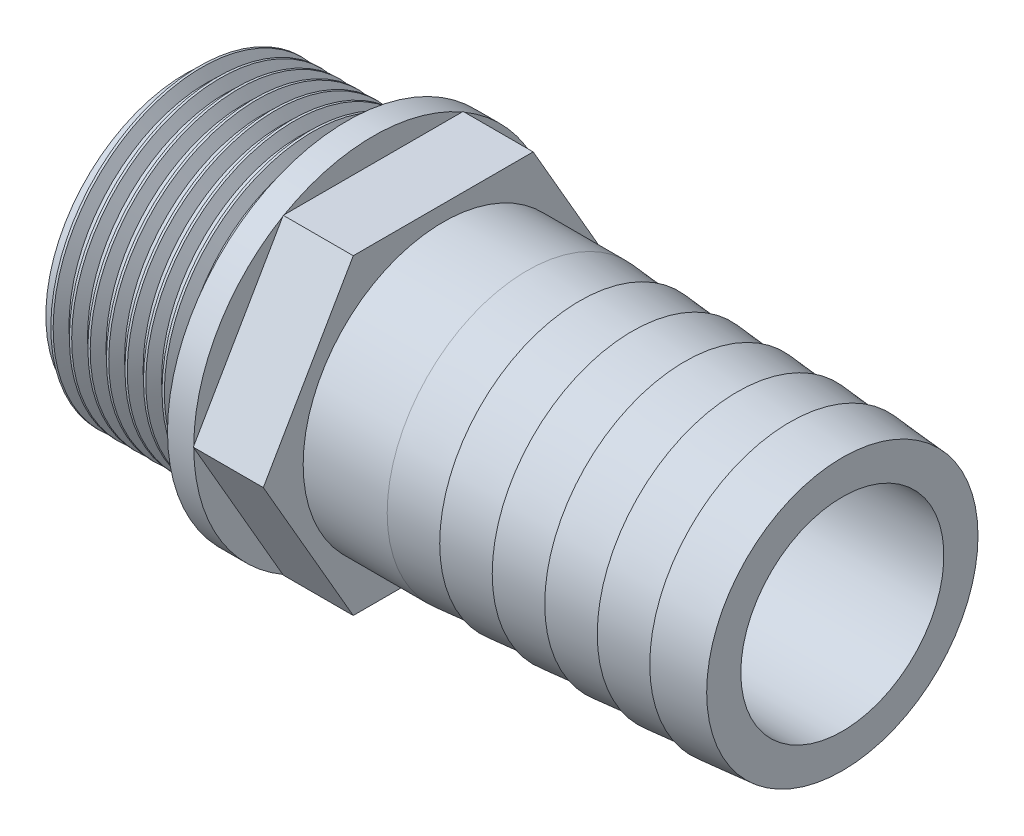
from build123d import *

# Parameters (mm, degrees)
DODANIE_WYCI_GNI_CIE1_START = 8
SZKIC2_R                    = 16
DODANIE_WYCI_GNI_CIE1_DEPTH = 8
GWINT1_PITCH                = 2.116666667


with BuildPart() as part:
    # Szkic1 → Obrót1 (revolve)
    with BuildSketch(Plane.XY, mode=Mode.PRIVATE) as obr_t1_sk:
        Polygon((0, 16), (9, 16), (15, 15.5), (15, 16), (21, 15.5), (21, 16), (27, 15.5), (27, 16), (33, 15.5), (33, 16), (39, 15.5), (39, 16), (45, 15.5), (45, 11.6), (-30, 11.6), (-30, 16), (-11.6, 16), (-11.6, 20.5), (-8.6, 20.5), (-8.6, 16), align=None)
    revolve(obr_t1_sk.sketch.rotate(Axis((0, 0, 0), (1, 0, 0)), 90), axis=Axis((0, 0, 0), (1, 0, 0)))

    # Szkic2 → Dodanie-wyciągnięcie1 (add)
    with BuildSketch(Plane(origin=(-8.6, 0, 0), x_dir=(0, 0, -1), z_dir=(1, 0, 0)).offset(DODANIE_WYCI_GNI_CIE1_START)):
        Polygon((20.553669583, 0), (10.276834792, 17.8), (-10.276834792, 17.8), (-20.553669583, 0), (-10.276834792, -17.8), (10.276834792, -17.8), align=None)
        with Locations(Location((0, 0, 0), (0, 0, 180))):
            Circle(SZKIC2_R, mode=Mode.SUBTRACT)
    extrude(amount=-DODANIE_WYCI_GNI_CIE1_DEPTH)

    # Gwint1: the profile of Profil gwintu1 profile screwed along a right-hand helix of 8.692913 turns, 10 arcs to a turn; built about Z, then put on its axis
    gwint1_z = Axis((0, 0, 0), (0, 0, 1))
    gwint1_corners = [(15.9997, 0, -0.000173205), (17.145679435, 0, 0.66145833), (17.145679435, 0, 0.926041664), (15.9997, 0, 1.587673199)]
    with BuildLine(mode=Mode.PRIVATE) as gwint1_profile:
        Line(gwint1_corners[0], gwint1_corners[1])
        Line(gwint1_corners[1], gwint1_corners[2])
        Line(gwint1_corners[2], gwint1_corners[3])
        Line(gwint1_corners[3], gwint1_corners[0])
    gwint1_cap = Face(gwint1_profile.wire())
    gwint1_turn_angles = [0, 18, 36, 54, 72, 90, 108, 126, 144, 162, 180, 198, 216, 234, 252, 270, 288, 306, 324, 342, 360]
    gwint1_turn_weights = [1, 0.9510565162951535, 1, 0.9510565162951535, 1, 0.9510565162951535, 1, 0.9510565162951535, 1, 0.9510565162951535, 1, 0.9510565162951535, 1, 0.9510565162951535, 1, 0.9510565162951535, 1, 0.9510565162951535, 1, 0.9510565162951535, 1]
    gwint1_turn_rails = [Edge.make_bspline([Vector(p[0], p[1], 0).rotate(gwint1_z, gwint1_turn_angles[k]) / gwint1_turn_weights[k] + Vector(0, 0, p[2] + GWINT1_PITCH * gwint1_turn_angles[k] / 360) for k in range(21)], [0, 0, 0, 1, 1, 2, 2, 3, 3, 4, 4, 5, 5, 6, 6, 7, 7, 8, 8, 9, 9, 10, 10, 10], 2, gwint1_turn_weights) for p in gwint1_corners]
    gwint1_turn_sides = [Face.make_surface_from_curves(gwint1_turn_rails[p[0]], gwint1_turn_rails[p[1]]) for p in [(0, 1), (1, 2), (2, 3), (3, 0)]]
    gwint1_last_angles = [2880, 2898, 2916, 2934, 2952, 2970, 2988, 3006, 3024, 3042, 3060, 3078, 3096, 3112.724409449, 3129.448818898]
    gwint1_last_weights = [1, 0.9510565162951535, 1, 0.9510565162951535, 1, 0.9510565162951535, 1, 0.9510565162951535, 1, 0.9510565162951535, 1, 0.9510565162951535, 1, 0.9576999850903692, 1]
    gwint1_last_rails = [Edge.make_bspline([Vector(p[0], p[1], 0).rotate(gwint1_z, gwint1_last_angles[k]) / gwint1_last_weights[k] + Vector(0, 0, p[2] + GWINT1_PITCH * gwint1_last_angles[k] / 360) for k in range(15)], [0, 0, 0, 1, 1, 2, 2, 3, 3, 4, 4, 5, 5, 6, 6, 7, 7, 7], 2, gwint1_last_weights) for p in gwint1_corners]
    gwint1_last_sides = [Face.make_surface_from_curves(gwint1_last_rails[p[0]], gwint1_last_rails[p[1]]) for p in [(0, 1), (1, 2), (2, 3), (3, 0)]]
    gwint1 = Plane(origin=(-30, 0, 0), x_dir=(0, 0, -1), z_dir=(1, 0, 0)) * Solid(Shell([*[p.moved(Location((0, 0, GWINT1_PITCH * i))) for i in range(8) for p in gwint1_turn_sides], *gwint1_last_sides, gwint1_cap, gwint1_cap.rotate(gwint1_z, 3129.448818898).moved(Location((0, 0, GWINT1_PITCH * 3129.448818898 / 360)))]))
    add(gwint1)


solid = part.part
